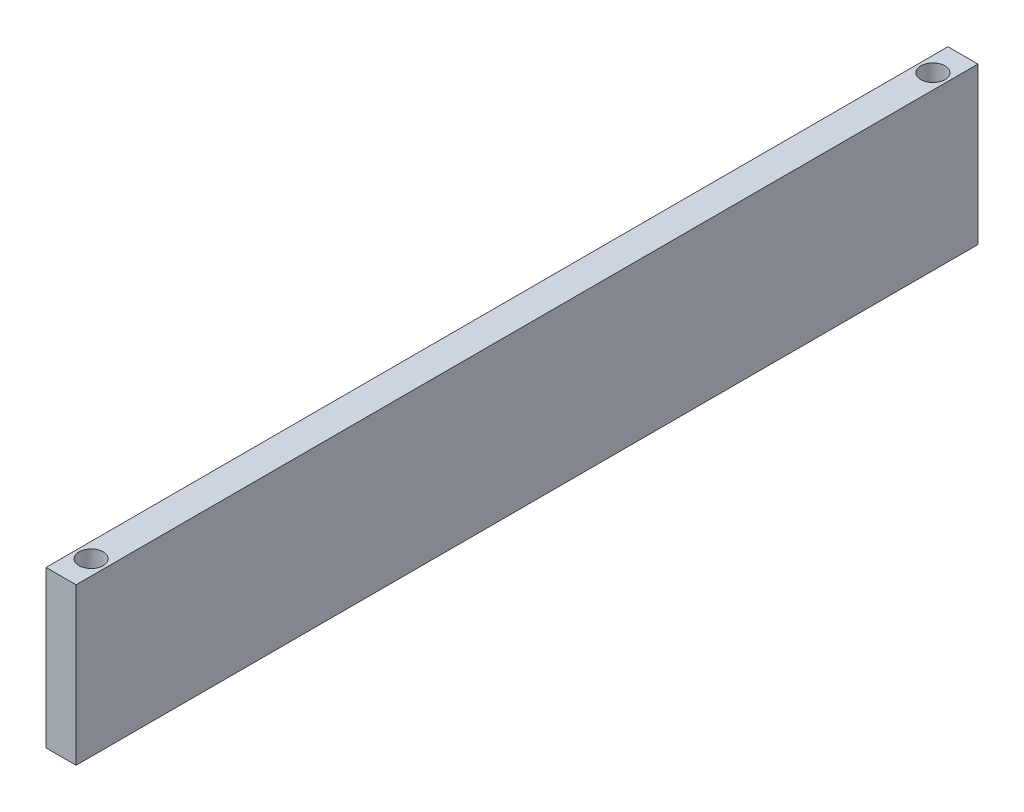
from build123d import *

# Parameters (mm, degrees)
SKETCH1_W           = 6.35
SKETCH1_H           = 33.02
BOSS_EXTRUDE1_DEPTH = 190.5
SKETCH3_R           = 2.54
CUT_EXTRUDE2_DEPTH  = 194.444805823


with BuildPart() as part:
    # Sketch1 → Boss-Extrude1 (new body)
    with BuildSketch(Plane.XY):
        with Locations((-3.175, 16.51)):
            Rectangle(SKETCH1_W, SKETCH1_H)
    extrude(amount=-BOSS_EXTRUDE1_DEPTH)

    # Sketch3 → Cut-Extrude2 (cut, through all)
    with BuildSketch(Plane(origin=(0, 33.02, 0), x_dir=(1, 0, 0), z_dir=(0, 1, 0))):
        with Locations((-3.175, 6.35)):
            Circle(SKETCH3_R)
        with Locations((-3.175, 184.15)):
            Circle(SKETCH3_R)
    extrude(amount=-CUT_EXTRUDE2_DEPTH, mode=Mode.SUBTRACT)


solid = part.part
